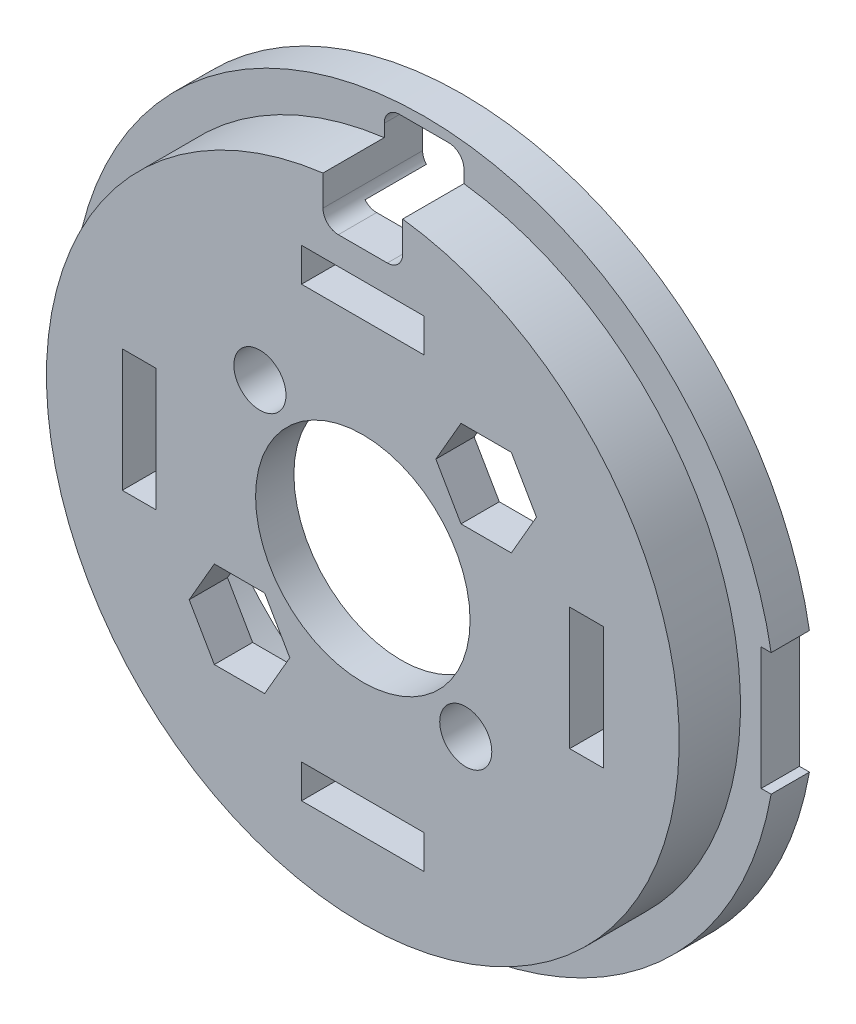
from build123d import *

# Parameters (mm, degrees)
SKETCH_1_R               = 17.4
EXTRUDE_1_DEPTH          = 5.6
SKETCH_2_R               = 1.7
CUT_EXTRUDE_1_DEPTH      = 26.23648153
SKETCH_3_R               = 7
CUT_EXTRUDE_2_DEPTH      = 26.23648153
SKETCH_4_R               = 2.8
CUT_EXTRUDE_3_DEPTH      = 3
SKETCH_5_R               = 1.7
CUT_EXTRUDE_4_DEPTH      = 26.23648153
CUT_EXTRUDE_5_DEPTH      = 2.5
SKETCH_7_W               = 16.1
SKETCH_7_H               = 16.1
CUT_EXTRUDE_6_DEPTH      = 1.5
CHAMFER_1_SIZE           = 0.5
SKETCH_9_W               = 2.2
SKETCH_9_H               = 8
SKETCH_9_W_2             = 8
SKETCH_9_H_2             = 2.2
CUT_EXTRUDE_7_DEPTH      = 26.281613873
BOSS_EXTRUDE1_DEPTH      = 5.6
BOSS_EXTRUDE1_DEPTH_BACK = 4
SKETCH1_R                = 20.65
SKETCH1_R_2              = 17.4
SKETCH3_R                = 23
SKETCH3_R_2              = 20.65
BOSS_EXTRUDE2_DEPTH      = 2.5
SKETCH4_R                = 18
CUT_EXTRUDE3_DEPTH       = 4
SKETCH5_W                = 1
SKETCH5_H                = 8
CUT_EXTRUDE4_DEPTH       = 10
CUT_EXTRUDE6_DEPTH       = 10
FILLET3_R                = 1
CUT_EXTRUDE7_START       = -3.1
SKETCH10_R               = 23
CUT_EXTRUDE7_DEPTH       = 3.1


with BuildPart() as part:
    # 草图1 → 凸台-拉伸1 (new body)
    with BuildSketch(Plane.XY):
        Circle(SKETCH_1_R)
    extrude(amount=EXTRUDE_1_DEPTH)

    # 草图2 → 切除-拉伸1 (cut, through all)
    with BuildSketch(Plane.XY.offset(5.6)):
        with Locations((-6.717514421, 6.717514421)):
            Circle(SKETCH_2_R)
        with Locations((6.717514421, -6.717514421)):
            Circle(SKETCH_2_R)
    extrude(amount=-CUT_EXTRUDE_1_DEPTH, mode=Mode.SUBTRACT)

    # 草图3 → 切除-拉伸2 (cut, through all)
    with BuildSketch(Plane.XY.offset(5.6)):
        Circle(SKETCH_3_R)
    extrude(amount=-CUT_EXTRUDE_2_DEPTH, mode=Mode.SUBTRACT)

    # 草图4 → 切除-拉伸3 (cut)
    with BuildSketch(Plane.XY.offset(5.6)):
        with Locations((-6.717514421, 6.717514421)):
            Circle(SKETCH_4_R)
        with Locations((6.717514421, -6.717514421)):
            Circle(SKETCH_4_R)
    extrude(amount=-CUT_EXTRUDE_3_DEPTH, mode=Mode.SUBTRACT)

    # 草图5 → 切除-拉伸4 (cut, through all)
    with BuildSketch(Plane.XY.offset(5.6)):
        with Locations((8.05, 8)):
            Circle(SKETCH_5_R)
        with Locations((-8.05, -8)):
            Circle(SKETCH_5_R)
    extrude(amount=-CUT_EXTRUDE_4_DEPTH, mode=Mode.SUBTRACT)

    # 草图6 → 切除-拉伸5 (cut)
    with BuildSketch(Plane(origin=(0, 0, 0), x_dir=(-1, 0, 0), z_dir=(0, 0, -1))):
        Polygon((4.766838493, -8), (6.408419246, -10.84330127), (9.691580754, -10.84330127), (11.333161507, -8), (9.691580754, -5.15669873), (6.408419246, -5.15669873), align=None)
        Polygon((-4.766838493, 8), (-6.408419246, 10.84330127), (-9.691580754, 10.84330127), (-11.333161507, 8), (-9.691580754, 5.15669873), (-6.408419246, 5.15669873), align=None)
    extrude(amount=-CUT_EXTRUDE_5_DEPTH, mode=Mode.SUBTRACT)

    # 草图7 → 切除-拉伸6 (cut)
    with BuildSketch(Plane.XY.offset(5.6)):
        Rectangle(SKETCH_7_W, SKETCH_7_H)
    extrude(amount=-CUT_EXTRUDE_6_DEPTH, mode=Mode.SUBTRACT)

    # 倒角1
    chamfer_1_edges = [part.edges().sort_by_distance(p)[0] for p in [
        (8.05, 1.022551258, 5.6),
        (1.047918985, 8.05, 5.6),
        (-8.05, -1.022551258, 5.6),
        (-1.047918985, -8.05, 5.6),
    ]]
    chamfer(chamfer_1_edges, length=CHAMFER_1_SIZE)

    # 草图8 → 旋转1 (revolve)
    with BuildSketch(Plane(origin=(0, 0, 0), x_dir=(0, 0, -1), z_dir=(1, 0, 0)), mode=Mode.PRIVATE) as revolve_1_sk:
        Polygon((0, 17.4), (0, 17.2), (0.2, 17.4), align=None)
    revolve(revolve_1_sk.sketch.rotate(Axis((0, 0, 0), (0, 0, 1)), 90), axis=Axis((0, 0, 0), (0, 0, 1)))

    # 草图9 → 切除-拉伸7 (cut, through all)
    with BuildSketch(Plane.XY.offset(5.6)):
        with Locations((14.6, 0)):
            Rectangle(SKETCH_9_W, SKETCH_9_H)
        with Locations((0, 14.6)):
            Rectangle(SKETCH_9_W_2, SKETCH_9_H_2)
        with Locations((-14.6, 0)):
            Rectangle(SKETCH_9_W, SKETCH_9_H)
        with Locations((0, -14.6)):
            Rectangle(SKETCH_9_W_2, SKETCH_9_H_2)
    extrude(amount=-CUT_EXTRUDE_7_DEPTH, mode=Mode.SUBTRACT)

    # Sketch1 → Boss-Extrude1 (add, two sides: drawn at the far end of the back side and taken through both)
    with BuildSketch(Plane.XY.offset(-BOSS_EXTRUDE1_DEPTH_BACK)):
        Circle(SKETCH1_R)
        Circle(SKETCH1_R_2, mode=Mode.SUBTRACT)
    extrude(amount=BOSS_EXTRUDE1_DEPTH + BOSS_EXTRUDE1_DEPTH_BACK)

    # Sketch3 → Boss-Extrude2 (add)
    with BuildSketch(Plane(origin=(0, 0, -4), x_dir=(-1, 0, 0), z_dir=(0, 0, -1))):
        Circle(SKETCH3_R)
        with Locations(Location((0, 0, 0), (0, 0, 180))):
            Circle(SKETCH3_R_2, mode=Mode.SUBTRACT)
    extrude(amount=-BOSS_EXTRUDE2_DEPTH)

    # Sketch4 → Cut-Extrude3 (cut)
    with BuildSketch(Plane(origin=(0, 0, -4), x_dir=(-1, 0, 0), z_dir=(0, 0, -1))):
        Circle(SKETCH4_R)
    extrude(amount=-CUT_EXTRUDE3_DEPTH, mode=Mode.SUBTRACT)

    # Sketch5 → Cut-Extrude4 (cut)
    with BuildSketch(Plane(origin=(0, 0, -4), x_dir=(-1, 0, 0), z_dir=(0, 0, -1))):
        with Locations((22.5, 0)):
            Rectangle(SKETCH5_W, SKETCH5_H)
        with Locations((-22.5, 0)):
            Rectangle(SKETCH5_W, SKETCH5_H)
    extrude(amount=-CUT_EXTRUDE4_DEPTH, mode=Mode.SUBTRACT)

    # Sketch7 → Cut-Extrude6 (cut)
    with BuildSketch(Plane(origin=(0, 0, -4), x_dir=(-1, 0, 0), z_dir=(0, 0, -1))):
        with BuildLine():
            Line((0, 18), (0, 22.3))
            Line((0, 22.3), (-2.6, 22.3))
            Line((-2.6, 22.3), (-2.6, 17.811232411))
            ThreePointArc((-2.6, 17.811232411), (-1.303421766, 17.952746077), (0, 18))
        make_face()
        with BuildLine():
            Line((0, 17.5), (0, 18))
            ThreePointArc((0, 18), (-1.303421766, 17.952746077), (-2.6, 17.811232411))
            Line((-2.6, 17.811232411), (-2.6, 17.5))
            Line((-2.6, 17.5), (0, 17.5))
        make_face()
        with BuildLine():
            Line((2.6, 22.3), (0, 22.3))
            Line((0, 22.3), (0, 18))
            ThreePointArc((0, 18), (1.303421766, 17.952746077), (2.6, 17.811232411))
            Line((2.6, 17.811232411), (2.6, 22.3))
        make_face()
        with BuildLine():
            ThreePointArc((2.6, 17.811232411), (1.303421766, 17.952746077), (0, 18))
            Line((0, 18), (0, 17.5))
            Line((0, 17.5), (2.6, 17.5))
            Line((2.6, 17.5), (2.6, 17.811232411))
        make_face()
    extrude(amount=-CUT_EXTRUDE6_DEPTH, mode=Mode.SUBTRACT)

    # Fillet3
    # the kernel refuses this fillet: 1 mm, written as the material it adds along each edge
    with BuildSketch(Plane(origin=(2.6, 22.3, -4), x_dir=(-1, 0, 0), z_dir=(0, 0, 1))) as fillet3_piece_1:
        with BuildLine():
            CenterArc((FILLET3_R, FILLET3_R), FILLET3_R, 180, 90)
            Line((0, FILLET3_R), (-FILLET3_R * 0.02, FILLET3_R))
            Line((-FILLET3_R * 0.02, FILLET3_R), (-FILLET3_R * 0.02, -FILLET3_R * 0.02))
            Line((-FILLET3_R * 0.02, -FILLET3_R * 0.02), (FILLET3_R, -FILLET3_R * 0.02))
            Line((FILLET3_R, -FILLET3_R * 0.02), (FILLET3_R, 0))
        make_face()
    extrude(amount=2.5)
    with BuildSketch(Plane(origin=(-2.6, 22.3, -4), x_dir=(1, 0, 0), z_dir=(0, 0, 1))) as fillet3_piece_2:
        with BuildLine():
            CenterArc((FILLET3_R, -FILLET3_R), FILLET3_R, 90, 90)
            Line((0, -FILLET3_R), (-FILLET3_R * 0.02, -FILLET3_R))
            Line((-FILLET3_R * 0.02, -FILLET3_R), (-FILLET3_R * 0.02, FILLET3_R * 0.02))
            Line((-FILLET3_R * 0.02, FILLET3_R * 0.02), (FILLET3_R, FILLET3_R * 0.02))
            Line((FILLET3_R, FILLET3_R * 0.02), (FILLET3_R, 0))
        make_face()
    extrude(amount=2.5)
    with BuildSketch(Plane(origin=(-2.6, 17.5, -6), x_dir=(0, 1, 0), z_dir=(0, 0, 1))) as fillet3_piece_3_section:
        with BuildLine():
            CenterArc((FILLET3_R, -FILLET3_R), FILLET3_R, 90, 90)
            Line((0, -FILLET3_R), (-FILLET3_R * 0.02, -FILLET3_R))
            Line((-FILLET3_R * 0.02, -FILLET3_R), (-FILLET3_R * 0.02, FILLET3_R * 0.02))
            Line((-FILLET3_R * 0.02, FILLET3_R * 0.02), (FILLET3_R, FILLET3_R * 0.02))
            Line((FILLET3_R, FILLET3_R * 0.02), (FILLET3_R, 0))
        make_face()
    fillet3_piece_3 = extrude(amount=11.6, mode=Mode.PRIVATE)
    fillet3_piece_3 = split(fillet3_piece_3, bisect_by=Plane(origin=(-2.544482942, 18.024809788, 0), z_dir=(0, 0, -1)), keep=Keep.TOP, mode=Mode.PRIVATE)
    fillet3_piece_3 = fillet3_piece_3 - Plane(origin=(0, 0, -2), x_dir=(-1, 0, 0), z_dir=(0, 0, -1)) * Cylinder(18, 28, mode=Mode.PRIVATE)
    fillet3_piece_3 = split(fillet3_piece_3, bisect_by=Plane(origin=(-2.544482942, 18.024809788, -4), z_dir=(0, 0, 1)), keep=Keep.TOP, mode=Mode.PRIVATE)
    add(fillet3_piece_3)
    with BuildSketch(Plane(origin=(-2.6, 17.5, 0), x_dir=(0, 1, 0), z_dir=(0, 0, 1))) as fillet3_piece_4_section:
        with BuildLine():
            CenterArc((FILLET3_R, -FILLET3_R), FILLET3_R, 90, 90)
            Line((0, -FILLET3_R), (-FILLET3_R * 0.02, -FILLET3_R))
            Line((-FILLET3_R * 0.02, -FILLET3_R), (-FILLET3_R * 0.02, FILLET3_R * 0.02))
            Line((-FILLET3_R * 0.02, FILLET3_R * 0.02), (FILLET3_R, FILLET3_R * 0.02))
            Line((FILLET3_R, FILLET3_R * 0.02), (FILLET3_R, 0))
        make_face()
    fillet3_piece_4 = extrude(amount=5.6, mode=Mode.PRIVATE)
    fillet3_piece_4 = fillet3_piece_4 - Plane(origin=(0, 0, 2.8), x_dir=(-1, 0, 0), z_dir=(0, 0, -1)) * Cylinder(18, 16, mode=Mode.PRIVATE)
    add(fillet3_piece_4)
    with BuildSketch(Plane(origin=(-2.6, 17.5, 0), x_dir=(0, 1, 0), z_dir=(0, 0, 1))) as fillet3_piece_5_section:
        with BuildLine():
            CenterArc((FILLET3_R, -FILLET3_R), FILLET3_R, 90, 90)
            Line((0, -FILLET3_R), (-FILLET3_R * 0.02, -FILLET3_R))
            Line((-FILLET3_R * 0.02, -FILLET3_R), (-FILLET3_R * 0.02, FILLET3_R * 0.02))
            Line((-FILLET3_R * 0.02, FILLET3_R * 0.02), (FILLET3_R, FILLET3_R * 0.02))
            Line((FILLET3_R, FILLET3_R * 0.02), (FILLET3_R, 0))
        make_face()
    fillet3_piece_5 = extrude(amount=5.6, mode=Mode.PRIVATE)
    fillet3_piece_5 = fillet3_piece_5 & Plane(origin=(0, 0, 2.8), x_dir=(-1, 0, 0), z_dir=(0, 0, -1)) * Cylinder(18, 16, mode=Mode.PRIVATE)
    add(fillet3_piece_5)
    with BuildSketch(Plane(origin=(2.6, 17.5, -6), x_dir=(-1, 0, 0), z_dir=(0, 0, 1))) as fillet3_piece_6_section:
        with BuildLine():
            CenterArc((FILLET3_R, -FILLET3_R), FILLET3_R, 90, 90)
            Line((0, -FILLET3_R), (-FILLET3_R * 0.02, -FILLET3_R))
            Line((-FILLET3_R * 0.02, -FILLET3_R), (-FILLET3_R * 0.02, FILLET3_R * 0.02))
            Line((-FILLET3_R * 0.02, FILLET3_R * 0.02), (FILLET3_R, FILLET3_R * 0.02))
            Line((FILLET3_R, FILLET3_R * 0.02), (FILLET3_R, 0))
        make_face()
    fillet3_piece_6 = extrude(amount=11.6, mode=Mode.PRIVATE)
    fillet3_piece_6 = split(fillet3_piece_6, bisect_by=Plane(origin=(2.544482942, 18.024809788, 0), z_dir=(0, 0, -1)), keep=Keep.TOP, mode=Mode.PRIVATE)
    fillet3_piece_6 = fillet3_piece_6 - Plane(origin=(0, 0, -2), x_dir=(-1, 0, 0), z_dir=(0, 0, -1)) * Cylinder(18, 28, mode=Mode.PRIVATE)
    fillet3_piece_6 = split(fillet3_piece_6, bisect_by=Plane(origin=(2.544482942, 18.024809788, -4), z_dir=(0, 0, 1)), keep=Keep.TOP, mode=Mode.PRIVATE)
    add(fillet3_piece_6)
    with BuildSketch(Plane(origin=(2.6, 17.5, 0), x_dir=(-1, 0, 0), z_dir=(0, 0, 1))) as fillet3_piece_7_section:
        with BuildLine():
            CenterArc((FILLET3_R, -FILLET3_R), FILLET3_R, 90, 90)
            Line((0, -FILLET3_R), (-FILLET3_R * 0.02, -FILLET3_R))
            Line((-FILLET3_R * 0.02, -FILLET3_R), (-FILLET3_R * 0.02, FILLET3_R * 0.02))
            Line((-FILLET3_R * 0.02, FILLET3_R * 0.02), (FILLET3_R, FILLET3_R * 0.02))
            Line((FILLET3_R, FILLET3_R * 0.02), (FILLET3_R, 0))
        make_face()
    fillet3_piece_7 = extrude(amount=5.6, mode=Mode.PRIVATE)
    fillet3_piece_7 = fillet3_piece_7 & Plane(origin=(0, 0, 2.8), x_dir=(-1, 0, 0), z_dir=(0, 0, -1)) * Cylinder(18, 16, mode=Mode.PRIVATE)
    add(fillet3_piece_7)
    with BuildSketch(Plane(origin=(2.6, 17.5, 0), x_dir=(-1, 0, 0), z_dir=(0, 0, 1))) as fillet3_piece_8_section:
        with BuildLine():
            CenterArc((FILLET3_R, -FILLET3_R), FILLET3_R, 90, 90)
            Line((0, -FILLET3_R), (-FILLET3_R * 0.02, -FILLET3_R))
            Line((-FILLET3_R * 0.02, -FILLET3_R), (-FILLET3_R * 0.02, FILLET3_R * 0.02))
            Line((-FILLET3_R * 0.02, FILLET3_R * 0.02), (FILLET3_R, FILLET3_R * 0.02))
            Line((FILLET3_R, FILLET3_R * 0.02), (FILLET3_R, 0))
        make_face()
    fillet3_piece_8 = extrude(amount=5.6, mode=Mode.PRIVATE)
    fillet3_piece_8 = fillet3_piece_8 - Plane(origin=(0, 0, 2.8), x_dir=(-1, 0, 0), z_dir=(0, 0, -1)) * Cylinder(18, 16, mode=Mode.PRIVATE)
    add(fillet3_piece_8)

    # Sketch10 → Cut-Extrude7 (cut)
    with BuildSketch(Plane.XY.offset(5.6).offset(CUT_EXTRUDE7_START)):
        Circle(SKETCH10_R)
    extrude(amount=CUT_EXTRUDE7_DEPTH, mode=Mode.SUBTRACT)


solid = part.part
